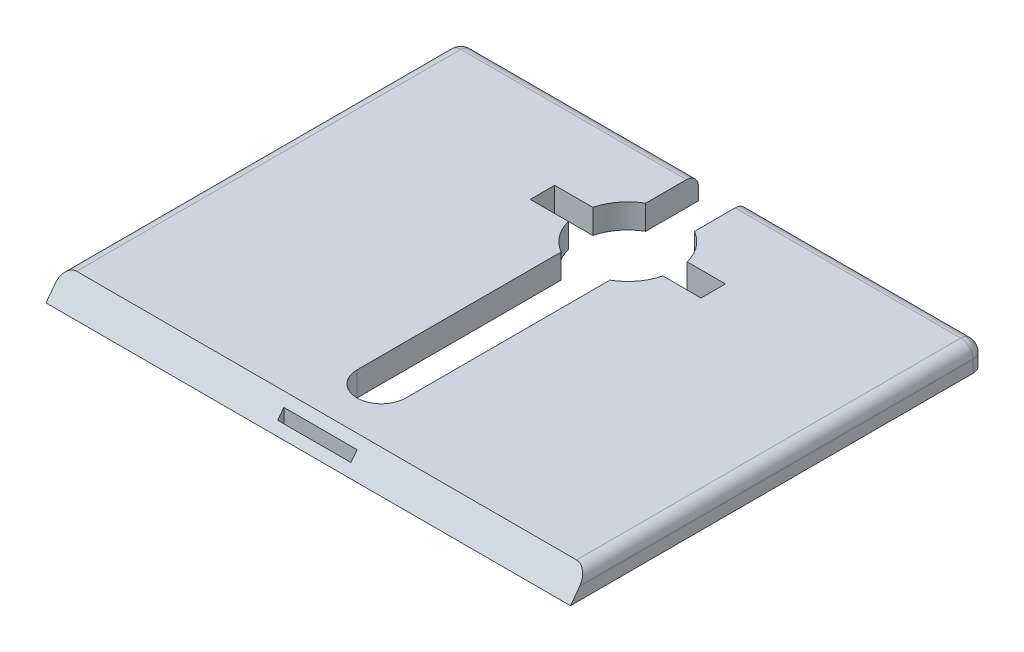
from build123d import *

# Parameters (mm, degrees)
SKIZZE1_W                       = 21.5
SKIZZE1_H                       = 17
AUFSATZ_LINEAR_AUSTRAGEN1_DEPTH = 1
VERRUNDUNG1_R                   = 0.5
SCHNITT_LINEAR_AUSTRAGEN1_REACH = 25.141
SKIZZE4_W                       = 3
SKIZZE4_H                       = 0.25
SCHNITT_LINEAR_AUSTRAGEN2_DEPTH = 1
VERRUNDUNG2_R                   = 0.5
SCHNITT_LINEAR_AUSTRAGEN3_DEPTH = 1
SCHNITT_LINEAR_START            = -1
SCHNITT_LINEAR_AUSTRAGEN4_DEPTH = 1


with BuildPart() as part:
    # Skizze1 → Aufsatz-Linear austragen1 (new body)
    with BuildSketch(Plane(origin=(0, 0, 0), x_dir=(1, 0, 0), z_dir=(0, 1, 0))):
        Rectangle(SKIZZE1_W, SKIZZE1_H)
    extrude(amount=AUFSATZ_LINEAR_AUSTRAGEN1_DEPTH)

    # Verrundung1
    verrundung1_edges = [part.edges().sort_by_distance(p)[0] for p in [
        (-10.75, 1, 0),
        (10.75, 1, 0),
        (0, 1, -8.5),
    ]]
    fillet(verrundung1_edges, radius=VERRUNDUNG1_R)

    # Schnitt-Linear austragen1: up to this face of the body (flat: up to its plane)
    schnitt_linear_austragen1_end = Plane(part.part.faces().sort_by_distance((10.75, 0.25, 0))[0])
    # Skizze2 → Schnitt-Linear austragen1 (cut, up to the picked face)
    with BuildSketch(Plane.ZY.offset(10.75), mode=Mode.PRIVATE) as schnitt_linear_austragen1_sk1:
        Polygon((8.5, 0), (7.75, 1), (8.5, 1), align=None)
    schnitt_linear_austragen1_tool1 = split(extrude(schnitt_linear_austragen1_sk1.sketch, amount=-SCHNITT_LINEAR_AUSTRAGEN1_REACH, mode=Mode.PRIVATE), bisect_by=schnitt_linear_austragen1_end, keep=Keep.BOTH, mode=Mode.PRIVATE)
    add(schnitt_linear_austragen1_tool1.solids().sort_by(Axis((-10.75, 0.666667, 8.25), (1, 0, 0)))[0], mode=Mode.SUBTRACT)

    # Skizze4 → Schnitt-Linear austragen2 (cut)
    with BuildSketch(Plane(origin=(0, 1, 0), x_dir=(1, 0, 0), z_dir=(0, 1, 0))):
        with Locations((0, -8.125)):
            Rectangle(SKIZZE4_W, SKIZZE4_H)
    extrude(amount=-SCHNITT_LINEAR_AUSTRAGEN2_DEPTH, mode=Mode.SUBTRACT)

    # Verrundung2
    # the kernel refuses this fillet: 0.5 mm, written as the material it takes off along each edge
    with BuildSketch(Plane(origin=(-10.25, 0.5, -8), x_dir=(0, 0, -1), z_dir=(-1, 0, 0))) as verrundung2_piece_1_section:
        Polygon((0, 0), (VERRUNDUNG2_R, 0), (VERRUNDUNG2_R, -VERRUNDUNG2_R), (0, -VERRUNDUNG2_R), align=None)
    verrundung2_piece_1 = extrude(amount=VERRUNDUNG2_R, mode=Mode.PRIVATE)
    verrundung2_piece_1 = verrundung2_piece_1 - Plane(origin=(-10.25, 0.5, -8), x_dir=(0, -0.7071067811865475, 0.7071067811865475), z_dir=(-1, 0, 0)) * Sphere(VERRUNDUNG2_R, mode=Mode.PRIVATE)
    add(verrundung2_piece_1, mode=Mode.SUBTRACT)
    with BuildSketch(Plane(origin=(10.25, 0.5, -8), x_dir=(0, 0, -1), z_dir=(1, 0, 0))) as verrundung2_piece_2_section:
        Polygon((0, 0), (VERRUNDUNG2_R, 0), (VERRUNDUNG2_R, VERRUNDUNG2_R), (0, VERRUNDUNG2_R), align=None)
    verrundung2_piece_2 = extrude(amount=VERRUNDUNG2_R, mode=Mode.PRIVATE)
    verrundung2_piece_2 = verrundung2_piece_2 - Plane(origin=(10.25, 0.5, -8), x_dir=(0, -0.7071067811865475, 0.7071067811865475), z_dir=(1, 0, 0)) * Sphere(VERRUNDUNG2_R, mode=Mode.PRIVATE)
    add(verrundung2_piece_2, mode=Mode.SUBTRACT)
    with BuildSketch(Plane(origin=(10.75, -1.25, -8.5), x_dir=(0, 0, 1), z_dir=(0, 1, 0))) as verrundung2_piece_3:
        with BuildLine():
            CenterArc((VERRUNDUNG2_R, -VERRUNDUNG2_R), VERRUNDUNG2_R, 90, 90)
            Line((0, -VERRUNDUNG2_R), (0, 0))
            Line((0, 0), (VERRUNDUNG2_R, 0))
        make_face()
    extrude(amount=1.75, mode=Mode.SUBTRACT)
    with BuildSketch(Plane(origin=(-10.75, -1.25, -8.5), x_dir=(0, 0, 1), z_dir=(0, 1, 0))) as verrundung2_piece_4:
        with BuildLine():
            CenterArc((VERRUNDUNG2_R, VERRUNDUNG2_R), VERRUNDUNG2_R, 180, 90)
            Line((0, VERRUNDUNG2_R), (0, 0))
            Line((0, 0), (VERRUNDUNG2_R, 0))
        make_face()
    extrude(amount=1.75, mode=Mode.SUBTRACT)

    # Skizze5 → Schnitt-Linear austragen3 (cut)
    with BuildSketch(Plane(origin=(0, 1, 0), x_dir=(1, 0, 0), z_dir=(0, 1, 0))):
        with BuildLine():
            Line((-3.5, 5.1), (-3.5, 4.1))
            Line((-3.5, 4.1), (-1.936491673, 4.1))
            ThreePointArc((-1.936491673, 4.1), (-2, 4.6), (-1.936491673, 5.1))
            Line((-1.936491673, 5.1), (-3.5, 5.1))
        make_face()
        with BuildLine():
            ThreePointArc((1.936491673, 5.1), (0, 6.6), (-1.936491673, 5.1))
            Line((-1.936491673, 5.1), (1.936491673, 5.1))
        make_face()
        with BuildLine():
            ThreePointArc((-1.936491673, 5.1), (-2, 4.6), (-1.936491673, 4.1))
            Line((-1.936491673, 4.1), (1.936491673, 4.1))
            ThreePointArc((1.936491673, 4.1), (1.984059393, 4.347991415), (2, 4.6))
            ThreePointArc((2, 4.6), (1.984059393, 4.852008585), (1.936491673, 5.1))
            Line((1.936491673, 5.1), (-1.936491673, 5.1))
        make_face()
        with BuildLine():
            Line((1.936491673, 4.1), (-1.936491673, 4.1))
            ThreePointArc((-1.936491673, 4.1), (0, 2.6), (1.936491673, 4.1))
        make_face()
        with BuildLine():
            ThreePointArc((2, 4.6), (1.984059393, 4.347991415), (1.936491673, 4.1))
            Line((1.936491673, 4.1), (3.5, 4.1))
            Line((3.5, 4.1), (3.5, 5.1))
            Line((3.5, 5.1), (1.936491673, 5.1))
            ThreePointArc((1.936491673, 5.1), (1.984059393, 4.852008585), (2, 4.6))
        make_face()
    extrude(amount=-SCHNITT_LINEAR_AUSTRAGEN3_DEPTH, mode=Mode.SUBTRACT)

    # Skizze6 → Schnitt-Linear austragen4 (cut)
    with BuildSketch(Plane(origin=(0, 1, 0), x_dir=(1, 0, 0), z_dir=(0, 1, 0)).offset(SCHNITT_LINEAR_START)):
        with BuildLine():
            Line((1, 8.5), (1, -5.5))
            ThreePointArc((1, -5.5), (0, -6.5), (-1, -5.5))
            Line((-1, -5.5), (-1, 8.5))
            ThreePointArc((-1, 8.5), (0, 9.5), (1, 8.5))
        make_face()
    extrude(amount=SCHNITT_LINEAR_AUSTRAGEN4_DEPTH, mode=Mode.SUBTRACT)


solid = part.part
